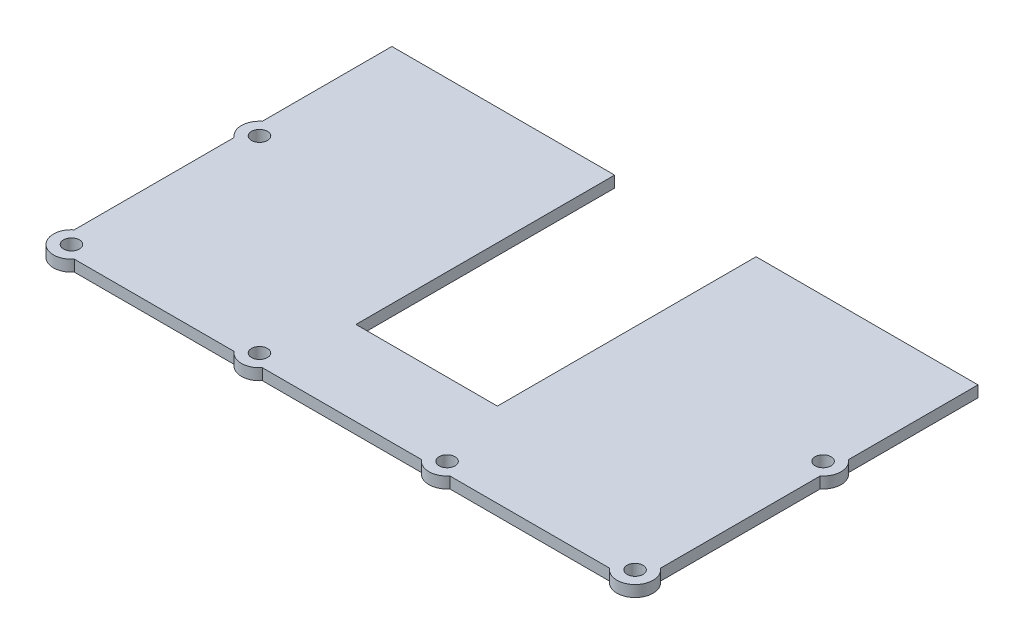
from build123d import *

# Parameters (mm, degrees)
SKETCH1_R           = 2.2479
BOSS_EXTRUDE1_DEPTH = 3.175


with BuildPart() as part:
    # Sketch1 → Boss-Extrude1 (new body)
    with BuildSketch(Plane(origin=(0, 0, 0), x_dir=(1, 0, 0), z_dir=(0, 1, 0))):
        with BuildLine():
            Line((62.70625, 0), (0, 0))
            Line((0, 0), (0, -36.474509804))
            ThreePointArc((0, -36.474509804), (-1.905, -40.440083533), (0, -44.405657262))
            Line((0, -44.405657262), (0, -89.391176471))
            ThreePointArc((0, -89.391176471), (-0.417102448, -96.948852648), (7.140573729, -96.5317502))
            Line((7.140573729, -96.5317502), (52.126092938, -96.5317502))
            ThreePointArc((52.126092938, -96.5317502), (56.091666667, -98.4367502), (60.057240396, -96.5317502))
            Line((60.057240396, -96.5317502), (63.5, -96.5317502))
            Line((63.5, -96.5317502), (69.85, -96.5317502))
            Line((69.85, -96.5317502), (95.25, -96.5317502))
            Line((95.25, -96.5317502), (101.6, -96.5317502))
            Line((101.6, -96.5317502), (104.917251774, -96.5317502))
            ThreePointArc((104.917251774, -96.5317502), (108.882825503, -98.4367502), (112.848399232, -96.5317502))
            Line((112.848399232, -96.5317502), (157.833918441, -96.5317502))
            ThreePointArc((157.833918441, -96.5317502), (165.391594618, -96.948852648), (164.97449217, -89.391176471))
            Line((164.97449217, -89.391176471), (164.97449217, -44.405657262))
            ThreePointArc((164.97449217, -44.405657262), (166.87949217, -40.440083533), (164.97449217, -36.474509804))
            Line((164.97449217, -36.474509804), (164.97449217, 0))
            Line((164.97449217, 0), (102.51925783, 0))
            Line((102.51925783, 0), (102.51925783, -72.821786637))
            Line((102.51925783, -72.821786637), (62.70625, -72.821786637))
            Line((62.70625, -72.821786637), (62.70625, 0))
        make_face()
        with Locations((3.175, -40.440083533)):
            Circle(SKETCH1_R, mode=Mode.SUBTRACT)
        with Locations((3.175, -93.3567502)):
            Circle(SKETCH1_R, mode=Mode.SUBTRACT)
        with Locations((56.091666667, -93.3567502)):
            Circle(SKETCH1_R, mode=Mode.SUBTRACT)
        with Locations((108.882825503, -93.3567502)):
            Circle(SKETCH1_R, mode=Mode.SUBTRACT)
        with Locations((161.79949217, -93.3567502)):
            Circle(SKETCH1_R, mode=Mode.SUBTRACT)
        with Locations((161.79949217, -40.440083533)):
            Circle(SKETCH1_R, mode=Mode.SUBTRACT)
    extrude(amount=BOSS_EXTRUDE1_DEPTH)


solid = part.part
